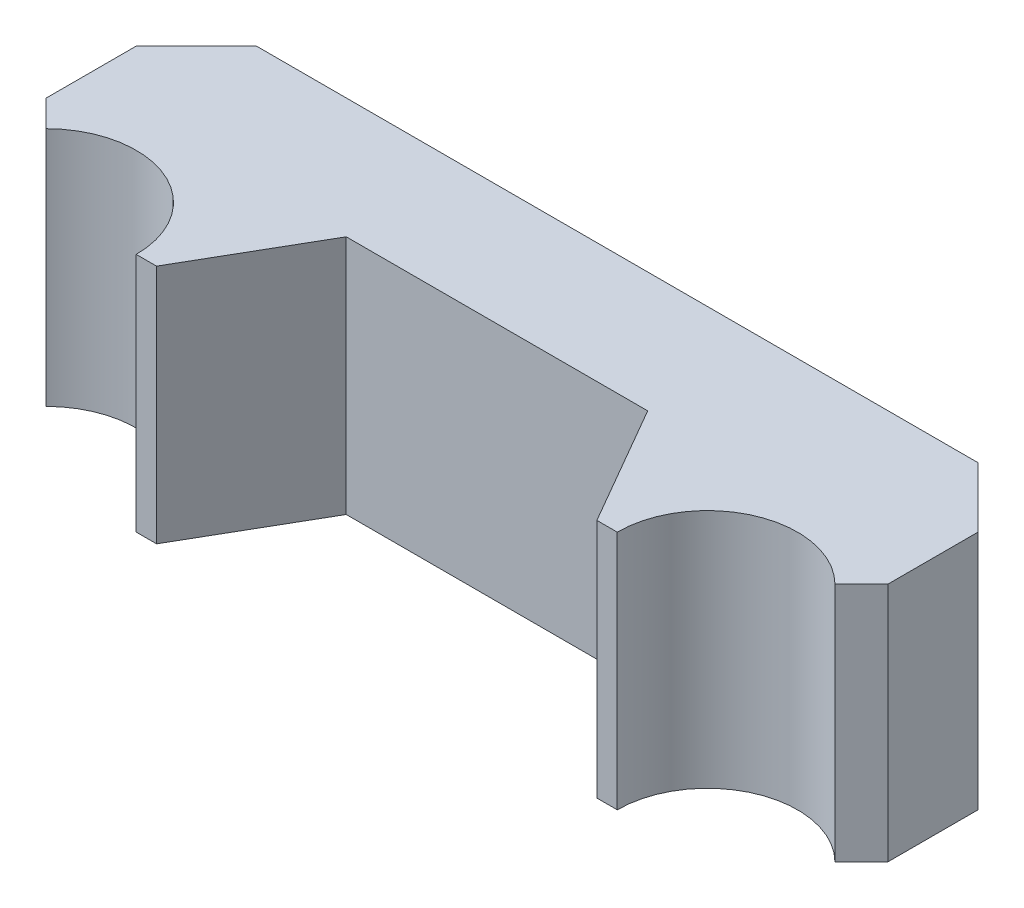
from build123d import *

# Parameters (mm, degrees)
BOSS_EXTRUDE1_START = -10
BOSS_EXTRUDE1_DEPTH = 20


# Read off the part's stored shape, not the designer's step: Boss-Extrude1
with BuildPart() as part:
    # Boss-Extrude1 outline → Boss-Extrude1 (new body)
    with BuildSketch(Plane(origin=(0, 0, 0), x_dir=(1, 0, 0), z_dir=(0, 1, 0)).offset(BOSS_EXTRUDE1_START)):
        with BuildLine():
            Line((-12.534244987, 10), (0, 10))
            Line((0, 10), (0, 20))
            Line((0, 20), (-30, 20))
            Line((-30, 20), (-35, 15))
            Line((-35, 15), (-35, 7.5))
            Line((-35, 7.5), (-32.803300859, 5.303300859))
            ThreePointArc((-32.803300859, 5.303300859), (-24.629874257, 6.929096494), (-20, 0))
            Line((-20, 0), (-18.307747679, 0))
            Line((-18.307747679, 0), (-12.534244987, 10))
        make_face()
    extrude(amount=BOSS_EXTRUDE1_DEPTH)

    # Mirror2: part across plane


with BuildPart() as part_1:
    add(part.part)
    add(part.part.mirror(Plane(origin=(0, 0, 0), x_dir=(0, 0, 1), z_dir=(1, 0, 0))))


solid = part_1.part
